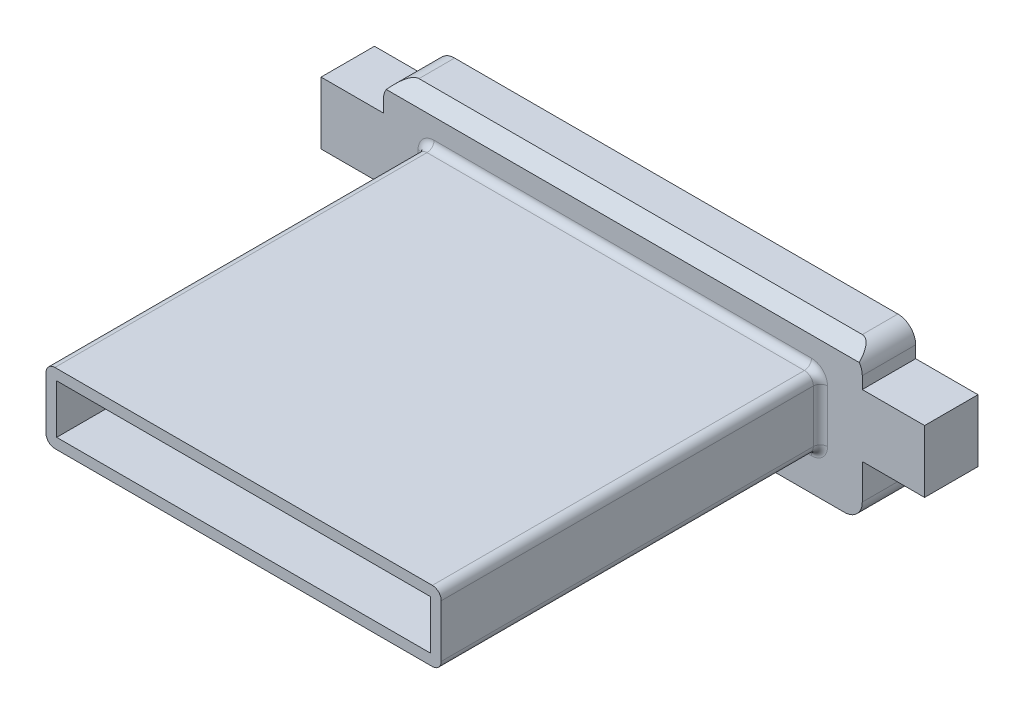
from build123d import *

# Parameters (mm, degrees)
SKETCH1_W           = 53.8
SKETCH1_H           = 16.8
SKETCH1_W_2         = 42
SKETCH1_H_2         = 5.5
BOSS_EXTRUDE1_DEPTH = 27
SKETCH4_W           = 53.8
SKETCH4_H           = 16.8
SKETCH4_W_2         = 44.4
SKETCH4_H_2         = 7.9
CUT_EXTRUDE2_DEPTH  = 19.35
SKETCH2_W           = 7
SKETCH2_H           = 10
BOSS_EXTRUDE2_DEPTH = 6
SKETCH3_R           = 1.35
CUT_EXTRUDE1_DEPTH  = 8
CUT_EXTRUDE4_REACH  = 66.31
SKETCH7_W           = 53.8
SKETCH7_H           = 0.5
FILLET2_R           = 1
FILETE1_R           = 2
SKETCH5_W           = 53.8
SKETCH5_H           = 16.8
CUT_EXTRUDE3_DEPTH  = 1.65
CUT_EXTRUDE5_REACH  = 63.565
CUT_EXTRUDE6_REACH  = 64.931
BOSS_EXTRUDE3_START = -7
SKETCH10_R          = 1.35
BOSS_EXTRUDE3_DEPTH = 7
CUT_EXTRUDE7_DEPTH  = 1.65
SKETCH13_W          = 6
SKETCH13_H          = 16.8
CUT_EXTRUDE8_DEPTH  = 73.869901194
FILLET6_R           = 0.8
BOSS_EXTRUDE4_START = 3.9
SKETCH14_W          = 42
SKETCH14_H          = 5.5
BOSS_EXTRUDE4_DEPTH = 3.9


with BuildPart() as part:
    # Sketch1 → Boss-Extrude1 (new, symmetric)
    with BuildSketch(Plane.XY):
        Rectangle(SKETCH1_W, SKETCH1_H)
        Rectangle(SKETCH1_W_2, SKETCH1_H_2, mode=Mode.SUBTRACT)
    extrude(amount=BOSS_EXTRUDE1_DEPTH, both=True)

    # Sketch4 → Cut-Extrude2 (cut, symmetric)
    with BuildSketch(Plane.XY):
        Rectangle(SKETCH4_W, SKETCH4_H)
        Rectangle(SKETCH4_W_2, SKETCH4_H_2, mode=Mode.SUBTRACT)
    extrude(amount=CUT_EXTRUDE2_DEPTH, both=True, mode=Mode.SUBTRACT)

    # Sketch2 → Boss-Extrude2 (add)
    with BuildSketch(Plane(origin=(0, 0, 19.35), x_dir=(-1, 0, 0), z_dir=(0, 0, -1))):
        with Locations((-30.4, 2.55)):
            Rectangle(SKETCH2_W, SKETCH2_H)
        with Locations((30.4, 2.55)):
            Rectangle(SKETCH2_W, SKETCH2_H)
    boss_extrude2 = extrude(amount=-BOSS_EXTRUDE2_DEPTH)

    # Sketch3 → Cut-Extrude1 (cut)
    with BuildSketch(Plane.XZ.offset(2.45)):
        with Locations((-30.9, 22.35)):
            Circle(SKETCH3_R)
        with Locations((30.9, 22.35)):
            Circle(SKETCH3_R)
    cut_extrude1 = extrude(amount=-CUT_EXTRUDE1_DEPTH, mode=Mode.SUBTRACT)

    # Mirror8: Boss-Extrude2, Cut-Extrude1 across plane
    add(boss_extrude2.mirror(Plane.XY))
    add(cut_extrude1.mirror(Plane.XY), mode=Mode.SUBTRACT)

    # Sketch7 → Cut-Extrude4 (cut, up to next)
    with BuildSketch(Plane(origin=(0, 0, -27), x_dir=(-1, 0, 0), z_dir=(0, 0, -1)), mode=Mode.PRIVATE) as cut_extrude4_sk1:
        with Locations((0, 8.15)):
            Rectangle(SKETCH7_W, SKETCH7_H)
    cut_extrude4_tool1 = extrude(cut_extrude4_sk1.sketch, amount=-CUT_EXTRUDE4_REACH, mode=Mode.PRIVATE) & part.part
    add(cut_extrude4_tool1.solids().sort_by_distance((0, 8.15, -27))[0], mode=Mode.SUBTRACT)

    # Fillet2
    fillet2_edges = [part.edges().sort_by_distance(p)[0] for p in [
        (-22.2, -3.95, 0),
        (-22.2, 3.95, 0),
        (22.2, 3.95, 0),
        (22.2, -3.95, 0),
    ]]
    fillet(fillet2_edges, radius=FILLET2_R)

    # Filete1
    filete1_edges = [part.edges().sort_by_distance(p)[0] for p in [
        (-26.9, -8.4, -23.175),
        (26.9, -8.4, -23.175),
        (26.9, -8.4, 23.175),
        (-26.9, -8.4, 23.175),
        (26.9, 8.4, 23.175),
        (-26.9, 8.4, 23.175),
        (-26.9, 7.9, -23.175),
        (26.9, 7.9, -23.175),
    ]]
    fillet(filete1_edges, radius=FILETE1_R)

    # Sketch5 → Cut-Extrude3 (cut)
    with BuildSketch(Plane.XY.offset(27)):
        Rectangle(SKETCH5_W, SKETCH5_H)
    extrude(amount=-CUT_EXTRUDE3_DEPTH, mode=Mode.SUBTRACT)

    # Chamfer1
    # the kernel refuses this chamfer: 2, 0.890457371 mm, written as the material it takes off along each edge
    with BuildSketch(Plane(origin=(-37.34003391, 7.9, -19.35), x_dir=(0, -0.9968798599783938, 0.07893379991776824), z_dir=(1, 0, 0))) as chamfer1_piece_1:
        with BuildLine():
            Line((0.925885194, 0), (-0.196073774, 2.064046904))
            Line((-0.196073774, 2.064046904), (-0.235948969, 2.060889552))
            ThreePointArc((-0.235948969, 2.060889552), (-0.121693379, 1.030150311), (-0.039875194, -0.003157352))
            Line((-0.039875194, -0.003157352), (0.003157352, -0.039875194))
            ThreePointArc((0.003157352, -0.039875194), (0.463215564, -0.003447392), (0.929042546, -0.039875194))
            Line((0.929042546, -0.039875194), (0.925885194, 0))
        make_face()
    extrude(amount=74.680067819, mode=Mode.SUBTRACT)

    # Sketch8 → Cut-Extrude5 (cut, up to next)
    with BuildSketch(Plane(origin=(0, 0, -25.35), x_dir=(-1, 0, 0), z_dir=(0, 0, -1)), mode=Mode.PRIVATE) as cut_extrude5_sk1:
        with BuildLine():
            Line((-26.030265456, 7.55), (-33.9, 7.55))
            Line((-33.9, 7.55), (-33.9, 4.55))
            Line((-33.9, 4.55), (-26.9, 4.55))
            Line((-26.9, 4.55), (-26.9, 5.9))
            ThreePointArc((-26.9, 5.9), (-26.669255622, 6.832595595), (-26.030265456, 7.55))
        make_face()
    cut_extrude5_tool1 = extrude(cut_extrude5_sk1.sketch, amount=-CUT_EXTRUDE5_REACH, mode=Mode.PRIVATE) & part.part
    # Sketch8 → Cut-Extrude5 (cut, up to next)
    with BuildSketch(Plane(origin=(0, 0, -25.35), x_dir=(-1, 0, 0), z_dir=(0, 0, -1)), mode=Mode.PRIVATE) as cut_extrude5_sk2:
        with BuildLine():
            Line((26.9, 4.55), (26.9, 5.9))
            ThreePointArc((26.9, 5.9), (26.669255622, 6.832595595), (26.030265456, 7.55))
            Line((26.030265456, 7.55), (33.9, 7.55))
            Line((33.9, 7.55), (33.9, 4.55))
            Line((33.9, 4.55), (26.9, 4.55))
        make_face()
    cut_extrude5_tool2 = extrude(cut_extrude5_sk2.sketch, amount=-CUT_EXTRUDE5_REACH, mode=Mode.PRIVATE) & part.part
    add(cut_extrude5_tool1.solids().sort_by_distance((30.325305, 6.072078, -25.35))[0], mode=Mode.SUBTRACT)
    add(cut_extrude5_tool2.solids().sort_by_distance((-30.325305, 6.072078, -25.35))[0], mode=Mode.SUBTRACT)

    # Sketch9 → Cut-Extrude6 (cut, up to next)
    with BuildSketch(Plane.XY.offset(25.35), mode=Mode.PRIVATE) as cut_extrude6_sk1:
        Polygon((26.9, 5.9), (26.9, 7.55), (33.9, 7.55), (33.9, 4.55), (26.9, 4.55), align=None)
    cut_extrude6_tool1 = extrude(cut_extrude6_sk1.sketch, amount=-CUT_EXTRUDE6_REACH, mode=Mode.PRIVATE) & part.part
    # Sketch9 → Cut-Extrude6 (cut, up to next)
    with BuildSketch(Plane.XY.offset(25.35), mode=Mode.PRIVATE) as cut_extrude6_sk2:
        Polygon((-26.9, 5.9), (-26.9, 4.55), (-33.9, 4.55), (-33.9, 7.55), (-26.9, 7.55), align=None)
    cut_extrude6_tool2 = extrude(cut_extrude6_sk2.sketch, amount=-CUT_EXTRUDE6_REACH, mode=Mode.PRIVATE) & part.part
    add(cut_extrude6_tool1.solids().sort_by_distance((30.4, 6.05, 25.35))[0], mode=Mode.SUBTRACT)
    add(cut_extrude6_tool2.solids().sort_by_distance((-30.4, 6.05, 25.35))[0], mode=Mode.SUBTRACT)

    # Sketch10 → Boss-Extrude3 (add)
    with BuildSketch(Plane(origin=(0, 4.55, 0), x_dir=(1, 0, 0), z_dir=(0, 1, 0)).offset(BOSS_EXTRUDE3_START)):
        with Locations((30.9, -22.35)):
            Circle(SKETCH10_R)
        with Locations((-30.9, -22.35)):
            Circle(SKETCH10_R)
    boss_extrude3 = extrude(amount=BOSS_EXTRUDE3_DEPTH)

    # Mirror9: Boss-Extrude3 across plane
    add(boss_extrude3.mirror(Plane.XY))

    # Sketch11 → Cut-Extrude7 (cut)
    with BuildSketch(Plane(origin=(0, 0, -27), x_dir=(-1, 0, 0), z_dir=(0, 0, -1))):
        with BuildLine():
            Line((26.9, -6.4), (26.9, 5.9))
            ThreePointArc((26.9, 5.9), (26.314213562, 7.314213562), (24.9, 7.9))
            Line((24.9, 7.9), (-24.9, 7.9))
            ThreePointArc((-24.9, 7.9), (-26.314213562, 7.314213562), (-26.9, 5.9))
            Line((-26.9, 5.9), (-26.9, -6.4))
            ThreePointArc((-26.9, -6.4), (-26.314213562, -7.814213562), (-24.9, -8.4))
            Line((-24.9, -8.4), (24.9, -8.4))
            ThreePointArc((24.9, -8.4), (26.314213562, -7.814213562), (26.9, -6.4))
        make_face()
    extrude(amount=-CUT_EXTRUDE7_DEPTH, mode=Mode.SUBTRACT)

    # Sketch13 → Cut-Extrude8 (cut, through all)
    with BuildSketch(Plane.ZY.offset(33.9)):
        with Locations((22.35, 0)):
            Rectangle(SKETCH13_W, SKETCH13_H)
    extrude(amount=-CUT_EXTRUDE8_DEPTH, mode=Mode.SUBTRACT)

    # Fillet6
    fillet6_edges = [part.edges().sort_by_distance(p)[0] for p in [
        (-22.2, 0, -19.35),
        (0, -3.95, -19.35),
        (22.2, 0, -19.35),
        (0, 3.95, -19.35),
        (-21.907106781, -3.657106781, -19.35),
        (21.907106781, -3.657106781, -19.35),
        (21.907106781, 3.657106781, -19.35),
        (-21.907106781, 3.657106781, -19.35),
    ]]
    fillet(fillet6_edges, radius=FILLET6_R)

    # Sketch14 → Boss-Extrude4 (add)
    with BuildSketch(Plane.XY.offset(19.35).offset(BOSS_EXTRUDE4_START)):
        with BuildLine():
            Line((22.2, -2.95), (22.2, 2.95))
            ThreePointArc((22.2, 2.95), (21.907106781, 3.657106781), (21.2, 3.95))
            Line((21.2, 3.95), (-21.2, 3.95))
            ThreePointArc((-21.2, 3.95), (-21.907106781, 3.657106781), (-22.2, 2.95))
            Line((-22.2, 2.95), (-22.2, -2.95))
            ThreePointArc((-22.2, -2.95), (-21.907106781, -3.657106781), (-21.2, -3.95))
            Line((-21.2, -3.95), (21.2, -3.95))
            ThreePointArc((21.2, -3.95), (21.907106781, -3.657106781), (22.2, -2.95))
        make_face()
        Rectangle(SKETCH14_W, SKETCH14_H, mode=Mode.SUBTRACT)
    extrude(amount=-BOSS_EXTRUDE4_DEPTH)


solid = part.part
